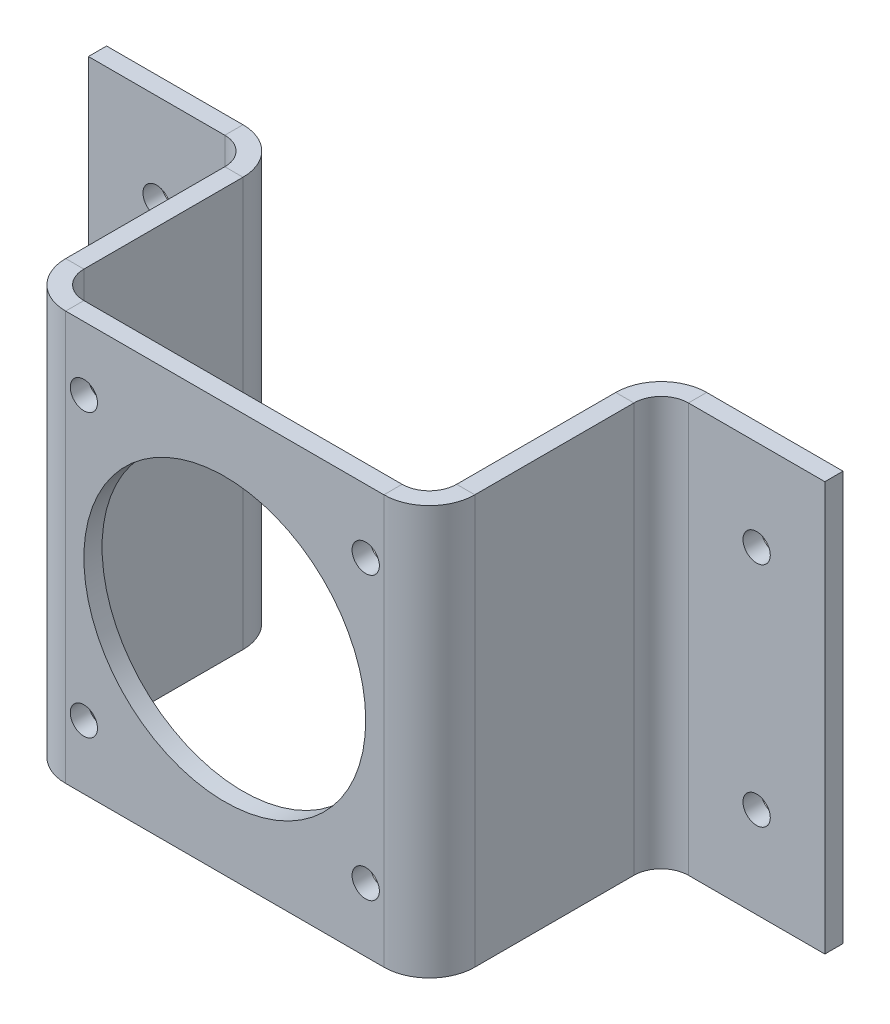
from build123d import *

# Parameters (mm, degrees)
SKETCH1_W                    = 45
SKETCH1_H                    = 45
SKETCH1_R                    = 15.5
SKETCH1_R_2                  = 1.5
BASE_FLANGE1_DEPTH           = 2
EDGE_FLANGE1_STRIP_W         = 14
EDGE_FLANGE1_STRIP_H         = 2
EDGE_FLANGE1_STRIP_CUT_DEPTH = 45
EDGE_FLANGE1_DEPTH           = 45
EDGE_FLANGE2_STRIP_W         = 14
EDGE_FLANGE2_STRIP_H         = 2
EDGE_FLANGE2_STRIP_CUT_DEPTH = 45
EDGE_FLANGE2_DEPTH           = 45
EDGE_FLANGE3_STRIP_W         = 14
EDGE_FLANGE3_STRIP_H         = 2
EDGE_FLANGE3_STRIP_CUT_DEPTH = 45
EDGE_FLANGE3_DEPTH           = 45
EDGE_FLANGE4_STRIP_W         = 14
EDGE_FLANGE4_STRIP_H         = 2
EDGE_FLANGE4_STRIP_CUT_DEPTH = 45
EDGE_FLANGE4_DEPTH           = 45
SKETCH18_R                   = 1.5
CUT_EXTRUDE1_DEPTH           = 10
SKETCH19_R                   = 1.5
CUT_EXTRUDE2_DEPTH           = 10


# Sheet-metal steps are written as plain solids
with BuildPart() as part:
    # Sketch1 → Base-Flange1 (new body)
    with BuildSketch(Plane.XY):
        Rectangle(SKETCH1_W, SKETCH1_H)
        Circle(SKETCH1_R, mode=Mode.SUBTRACT)
        with Locations((-15.5, 15.5)):
            Circle(SKETCH1_R_2, mode=Mode.SUBTRACT)
        with Locations((15.5, 15.5)):
            Circle(SKETCH1_R_2, mode=Mode.SUBTRACT)
        with Locations((15.5, -15.5)):
            Circle(SKETCH1_R_2, mode=Mode.SUBTRACT)
        with Locations((-15.5, -15.5)):
            Circle(SKETCH1_R_2, mode=Mode.SUBTRACT)
    extrude(amount=-BASE_FLANGE1_DEPTH)

    # Edge-Flange1 strip (across the edge) → Edge-Flange1 strip cut (cut)
    with BuildSketch(Plane(origin=(22.5, 22.5, -2), x_dir=(-1, 0, 0), z_dir=(0, -1, 0))):
        with Locations((-2, -1)):
            Rectangle(EDGE_FLANGE1_STRIP_W, EDGE_FLANGE1_STRIP_H)
    extrude(amount=EDGE_FLANGE1_STRIP_CUT_DEPTH, mode=Mode.SUBTRACT)

    # Edge-Flange1 section (across the edge) → Edge-Flange1 (add)
    with BuildSketch(Plane(origin=(22.5, 22.5, -2), x_dir=(-1, 0, 0), z_dir=(0, -1, 0))):
        with BuildLine():
            Line((0, 3), (0, 25.5))
            Line((0, 25.5), (2, 25.5))
            Line((2, 25.5), (2, 3))
            ThreePointArc((2, 3), (2.878679656, 0.878679656), (5, 0))
            Line((5, 0), (5, -2))
            ThreePointArc((5, -2), (1.464466094, -0.535533906), (0, 3))
        make_face()
    extrude(amount=EDGE_FLANGE1_DEPTH)

    # Edge-Flange2 strip (across the edge) → Edge-Flange2 strip cut (cut)
    with BuildSketch(Plane(origin=(22.5, -22.5, -27.5), x_dir=(0, 0, 1), z_dir=(0, 1, 0))):
        with Locations((-2, -1)):
            Rectangle(EDGE_FLANGE2_STRIP_W, EDGE_FLANGE2_STRIP_H)
    extrude(amount=EDGE_FLANGE2_STRIP_CUT_DEPTH, mode=Mode.SUBTRACT)

    # Edge-Flange2 section (across the edge) → Edge-Flange2 (add)
    with BuildSketch(Plane(origin=(22.5, -22.5, -27.5), x_dir=(0, 0, 1), z_dir=(0, 1, 0))):
        with BuildLine():
            Line((0, 3), (0, 18))
            Line((0, 18), (2, 18))
            Line((2, 18), (2, 3))
            ThreePointArc((2, 3), (2.878679656, 0.878679656), (5, 0))
            Line((5, 0), (5, -2))
            ThreePointArc((5, -2), (1.464466094, -0.535533906), (0, 3))
        make_face()
    extrude(amount=EDGE_FLANGE2_DEPTH)

    # Edge-Flange3 strip (across the edge) → Edge-Flange3 strip cut (cut)
    with BuildSketch(Plane(origin=(-22.5, -22.5, -2), x_dir=(1, 0, 0), z_dir=(0, 1, 0))):
        with Locations((-2, -1)):
            Rectangle(EDGE_FLANGE3_STRIP_W, EDGE_FLANGE3_STRIP_H)
    extrude(amount=EDGE_FLANGE3_STRIP_CUT_DEPTH, mode=Mode.SUBTRACT)

    # Edge-Flange3 section (across the edge) → Edge-Flange3 (add)
    with BuildSketch(Plane(origin=(-22.5, -22.5, -2), x_dir=(1, 0, 0), z_dir=(0, 1, 0))):
        with BuildLine():
            Line((0, 3), (0, 25.5))
            Line((0, 25.5), (2, 25.5))
            Line((2, 25.5), (2, 3))
            ThreePointArc((2, 3), (2.878679656, 0.878679656), (5, 0))
            Line((5, 0), (5, -2))
            ThreePointArc((5, -2), (1.464466094, -0.535533906), (0, 3))
        make_face()
    extrude(amount=EDGE_FLANGE3_DEPTH)

    # Edge-Flange4 strip (across the edge) → Edge-Flange4 strip cut (cut)
    with BuildSketch(Plane(origin=(-22.5, 22.5, -27.5), x_dir=(0, 0, 1), z_dir=(0, -1, 0))):
        with Locations((-2, -1)):
            Rectangle(EDGE_FLANGE4_STRIP_W, EDGE_FLANGE4_STRIP_H)
    extrude(amount=EDGE_FLANGE4_STRIP_CUT_DEPTH, mode=Mode.SUBTRACT)

    # Edge-Flange4 section (across the edge) → Edge-Flange4 (add)
    with BuildSketch(Plane(origin=(-22.5, 22.5, -27.5), x_dir=(0, 0, 1), z_dir=(0, -1, 0))):
        with BuildLine():
            Line((0, 3), (0, 18))
            Line((0, 18), (2, 18))
            Line((2, 18), (2, 3))
            ThreePointArc((2, 3), (2.878679656, 0.878679656), (5, 0))
            Line((5, 0), (5, -2))
            ThreePointArc((5, -2), (1.464466094, -0.535533906), (0, 3))
        make_face()
    extrude(amount=EDGE_FLANGE4_DEPTH)

    # Sketch18 → Cut-Extrude1 (cut)
    with BuildSketch(Plane.XY.offset(-25.5)):
        with Locations((-33, 12.5)):
            Circle(SKETCH18_R)
        with Locations((-33, -12.5)):
            Circle(SKETCH18_R)
    extrude(amount=-CUT_EXTRUDE1_DEPTH, mode=Mode.SUBTRACT)

    # Sketch19 → Cut-Extrude2 (cut)
    with BuildSketch(Plane.XY.offset(-25.5)):
        with Locations((33, 12.5)):
            Circle(SKETCH19_R)
        with Locations((33, -12.5)):
            Circle(SKETCH19_R)
    extrude(amount=-CUT_EXTRUDE2_DEPTH, mode=Mode.SUBTRACT)


solid = part.part
